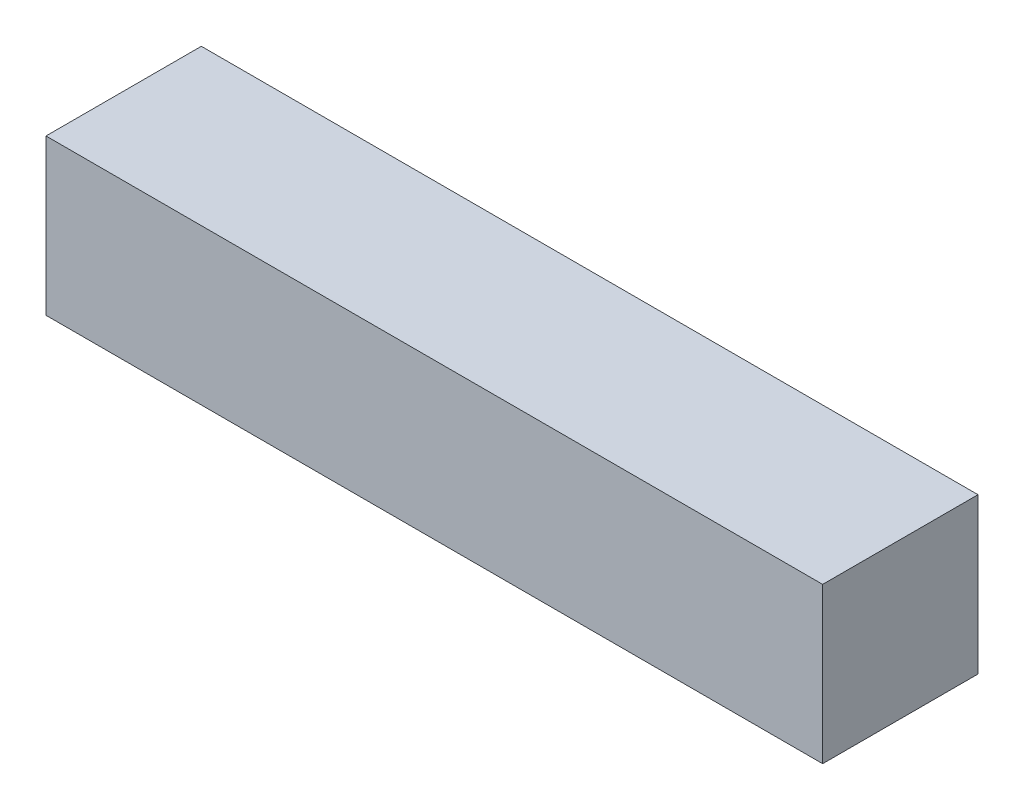
from build123d import *

# Parameters (mm, degrees)
BOSS_EXTRUDE1_DEPTH      = 50
BOSS_EXTRUDE1_DEPTH_BACK = 50
SKETCH2_W                = 20
SKETCH2_H                = 20


with BuildPart() as part:
    # Sketch2 → Boss-Extrude1 (new, two sides: drawn at the far end of the back side and taken through both)
    with BuildSketch(Plane(origin=(0, 0, 0), x_dir=(0, 0, -1), z_dir=(1, 0, 0)).offset(-BOSS_EXTRUDE1_DEPTH_BACK)):
        Rectangle(SKETCH2_W, SKETCH2_H)
    extrude(amount=BOSS_EXTRUDE1_DEPTH + BOSS_EXTRUDE1_DEPTH_BACK)


solid = part.part
